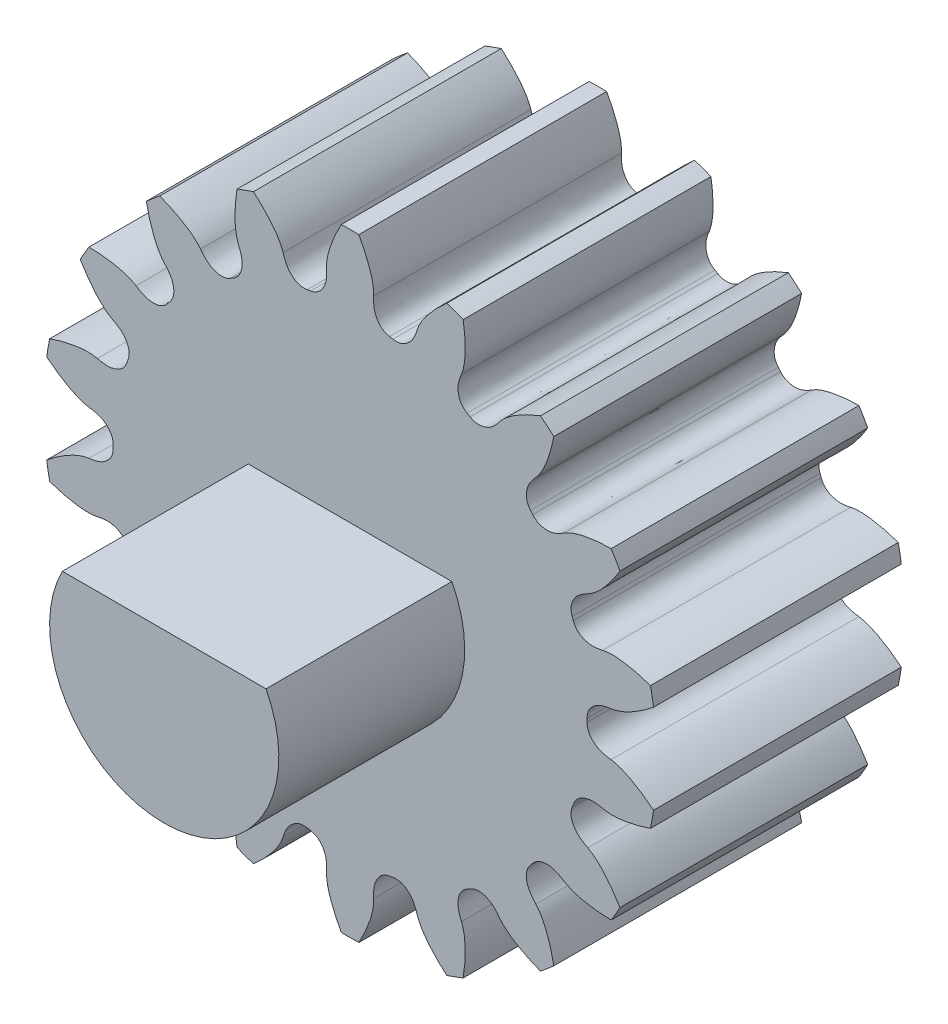
from build123d import *

# Parameters (mm, degrees)
SKETCH1_R           = 5.5
EXTRUDE1_DEPTH      = 4
EXTRUDE2_DEPTH      = 3
EXTRUDE3_DEPTH      = 3.5
EXTRUDE5_DEPTH      = 11.464224768
EXTRUDE5_DEPTH_BACK = 11.464224768
SKETCH4_R           = 6.338783536


with BuildPart() as part:
    # Sketch1 → Extrude1 (new body)
    with BuildSketch(Plane.XY):
        Circle(SKETCH1_R)
    extrude(amount=EXTRUDE1_DEPTH)

    # Sketch2 → Extrude2 (add)
    with BuildSketch(Plane.XY.offset(4)):
        with BuildLine():
            ThreePointArc((-1.643167673, 0.85), (0, -1.85), (1.643167673, 0.85))
            Line((1.643167673, 0.85), (-1.643167673, 0.85))
        make_face()
    extrude(amount=EXTRUDE2_DEPTH)

    # Sketch3 → Extrude3 (cut)
    with BuildSketch(Plane(origin=(0, 0, 0), x_dir=(-1, 0, 0), z_dir=(0, 0, -1))):
        with BuildLine():
            ThreePointArc((-1.183215957, 1.15), (0, -1.65), (1.183215957, 1.15))
            Line((1.183215957, 1.15), (-1.183215957, 1.15))
        make_face()
    extrude(amount=-EXTRUDE3_DEPTH, mode=Mode.SUBTRACT)

    # Sketch4 → Extrude5 (cut, two sides: drawn at the far end of the back side and taken through both)
    with BuildSketch(Plane.XY.offset(-EXTRUDE5_DEPTH_BACK)):
        Circle(SKETCH4_R)
        with BuildLine():
            ThreePointArc((-0.691151214, 3.762038676), (-0.66420428, 3.766889655), (-0.637223312, 3.77154762))
            add(Edge.make_bspline(
                [(-0.381405681, 4.210463921), (-0.375972683, 4.159720025), (-0.383883595, 4.03873467), (-0.414747483, 3.946280352), (-0.490121942, 3.822486209), (-0.574468933, 3.782224973), (-0.637223312, 3.77154762)],
                knots=[0.015932796, 0.015932796, 0.015932796, 0.015932796, 1.139046187, 2.262159578, 4.50838636, 9.000839924, 9.000839924, 9.000839924, 9.000839924], degree=3))
            add(Edge.make_bspline(
                [(-0.141013461, 4.947991027), (-0.20898124, 4.828846411), (-0.328175986, 4.566308486), (-0.383593226, 4.333731547), (-0.381405681, 4.210463921)],
                knots=[0.026609296, 0.026609296, 0.026609296, 0.026609296, 4.373386474, 8.720163651, 8.720163651, 8.720163651, 8.720163651], degree=3))
            ThreePointArc((-0.141013461, 4.947991027), (0, 4.95), (0.141013461, 4.947991027))
            add(Edge.make_bspline(
                [(0.381405681, 4.210463921), (0.383593226, 4.333731547), (0.328175986, 4.566308486), (0.20898124, 4.828846411), (0.141013461, 4.947991027)],
                knots=[0.026609296, 0.026609296, 0.026609296, 0.026609296, 4.373386474, 8.720163651, 8.720163651, 8.720163651, 8.720163651], degree=3))
            add(Edge.make_bspline(
                [(0.637223312, 3.77154762), (0.574468933, 3.782224973), (0.490121942, 3.822486209), (0.414747483, 3.946280352), (0.383883595, 4.03873467), (0.375972683, 4.159720025), (0.381405681, 4.210463921)],
                knots=[0.015932796, 0.015932796, 0.015932796, 0.015932796, 4.50838636, 6.754613142, 7.877726533, 9.000839924, 9.000839924, 9.000839924, 9.000839924], degree=3))
            ThreePointArc((0.637223312, 3.77154762), (0.66420428, 3.766889655), (0.691151214, 3.762038676))
            add(Edge.make_bspline(
                [(1.081659369, 4.086990302), (1.069409283, 4.037448443), (1.020596029, 3.926465089), (0.959972222, 3.85014252), (0.846803309, 3.75959366), (0.75377291, 3.750608844), (0.691151214, 3.762038676)],
                knots=[0.015932796, 0.015932796, 0.015932796, 0.015932796, 1.139046187, 2.262159578, 4.50838636, 9.000839924, 9.000839924, 9.000839924, 9.000839924], degree=3))
            add(Edge.make_bspline(
                [(1.559803292, 4.6978201), (1.455184612, 4.609107133), (1.253384931, 4.403169186), (1.121763761, 4.203572165), (1.081659369, 4.086990302)],
                knots=[0.026609296, 0.026609296, 0.026609296, 0.026609296, 4.373386474, 8.720163651, 8.720163651, 8.720163651, 8.720163651], degree=3))
            ThreePointArc((1.559803292, 4.6978201), (1.692999709, 4.651478473), (1.824821909, 4.601361212))
            add(Edge.make_bspline(
                [(1.798467578, 3.826093451), (1.842683209, 3.941178945), (1.870154035, 4.178683591), (1.847940871, 4.466155545), (1.824821909, 4.601361212)],
                knots=[0.026609296, 0.026609296, 0.026609296, 0.026609296, 4.373386474, 8.720163651, 8.720163651, 8.720163651, 8.720163651], degree=3))
            add(Edge.make_bspline(
                [(1.888739301, 3.326152259), (1.833421345, 3.35764895), (1.767931253, 3.424330507), (1.739442521, 3.566438533), (1.742061192, 3.663873244), (1.776006795, 3.780267981), (1.798467578, 3.826093451)],
                knots=[0.015932796, 0.015932796, 0.015932796, 0.015932796, 4.50838636, 6.754613142, 7.877726533, 9.000839924, 9.000839924, 9.000839924, 9.000839924], degree=3))
            ThreePointArc((1.888739301, 3.326152259), (1.9125, 3.312547169), (1.936162703, 3.298772346))
            add(Edge.make_bspline(
                [(2.414260337, 3.470565336), (2.385804707, 3.428200992), (2.301976709, 3.34060587), (2.21890511, 3.289620678), (2.081591583, 3.243238631), (1.991098615, 3.266613936), (1.936162703, 3.298772346)],
                knots=[0.015932796, 0.015932796, 0.015932796, 0.015932796, 1.139046187, 2.262159578, 4.50838636, 9.000839924, 9.000839924, 9.000839924, 9.000839924], degree=3))
            add(Edge.make_bspline(
                [(3.072484747, 3.881022736), (2.943833724, 3.833441512), (2.683769127, 3.708942699), (2.491819483, 3.566399942), (2.414260337, 3.470565336)],
                knots=[0.026609296, 0.026609296, 0.026609296, 0.026609296, 4.373386474, 8.720163651, 8.720163651, 8.720163651, 8.720163651], degree=3))
            ThreePointArc((3.072484747, 3.881022736), (3.181798668, 3.791919993), (3.288529903, 3.699739326))
            add(Edge.make_bspline(
                [(2.998607742, 2.980239643), (3.079518401, 3.073261997), (3.186563907, 3.287047784), (3.26401156, 3.564780408), (3.288529903, 3.699739326)],
                knots=[0.026609296, 0.026609296, 0.026609296, 0.026609296, 4.373386474, 8.720163651, 8.720163651, 8.720163651, 8.720163651], degree=3))
            add(Edge.make_bspline(
                [(2.912445457, 2.479573847), (2.871236084, 2.528090911), (2.832501963, 2.613150008), (2.854335119, 2.756431592), (2.8901205, 2.847094632), (2.961828276, 2.944859827), (2.998607742, 2.980239643)],
                knots=[0.015932796, 0.015932796, 0.015932796, 0.015932796, 4.50838636, 6.754613142, 7.877726533, 9.000839924, 9.000839924, 9.000839924, 9.000839924], degree=3))
            ThreePointArc((2.912445457, 2.479573847), (2.930119995, 2.458662607), (2.947644395, 2.437625386))
            add(Edge.make_bspline(
                [(3.455665876, 2.435538969), (3.414436872, 2.405461907), (3.305705025, 2.351820281), (3.210205294, 2.332322032), (3.065309192, 2.335701157), (2.988268443, 2.388617176), (2.947644395, 2.437625386)],
                knots=[0.015932796, 0.015932796, 0.015932796, 0.015932796, 1.139046187, 2.262159578, 4.50838636, 9.000839924, 9.000839924, 9.000839924, 9.000839924], degree=3))
            add(Edge.make_bspline(
                [(4.214579197, 2.596116753), (4.077413043, 2.595406269), (3.790451158, 2.567362983), (3.561325, 2.499067252), (3.455665876, 2.435538969)],
                knots=[0.026609296, 0.026609296, 0.026609296, 0.026609296, 4.373386474, 8.720163651, 8.720163651, 8.720163651, 8.720163651], degree=3))
            ThreePointArc((4.214579197, 2.596116753), (4.286825749, 2.475), (4.355592657, 2.351874274))
            add(Edge.make_bspline(
                [(3.837071558, 1.774924951), (3.944918226, 1.834664295), (4.118627143, 1.998945503), (4.286394283, 2.233440142), (4.355592657, 2.351874274)],
                knots=[0.026609296, 0.026609296, 0.026609296, 0.026609296, 4.373386474, 8.720163651, 8.720163651, 8.720163651, 8.720163651], degree=3))
            add(Edge.make_bspline(
                [(3.584867706, 1.333922234), (3.562737376, 1.393607796), (3.555431134, 1.486785052), (3.624952777, 1.61395832), (3.689588621, 1.686914389), (3.790409556, 1.754258118), (3.837071558, 1.774924951)],
                knots=[0.015932796, 0.015932796, 0.015932796, 0.015932796, 4.50838636, 6.754613142, 7.877726533, 9.000839924, 9.000839924, 9.000839924, 9.000839924], degree=3))
            ThreePointArc((3.584867706, 1.333922234), (3.594324275, 1.308227048), (3.60359667, 1.282464829))
            add(Edge.make_bspline(
                [(4.080267111, 1.106750659), (4.031237559, 1.092588615), (3.910716528, 1.079370457), (3.814307342, 1.093710928), (3.679305272, 1.146443653), (3.625008994, 1.222517933), (3.60359667, 1.282464829)],
                knots=[0.015932796, 0.015932796, 0.015932796, 0.015932796, 1.139046187, 2.262159578, 4.50838636, 9.000839924, 9.000839924, 9.000839924, 9.000839924], degree=3))
            add(Edge.make_bspline(
                [(4.848333195, 0.998080774), (4.719196172, 1.044326725), (4.439948838, 1.116121402), (4.201282162, 1.130310169), (4.080267111, 1.106750659)],
                knots=[0.026609296, 0.026609296, 0.026609296, 0.026609296, 4.373386474, 8.720163651, 8.720163651, 8.720163651, 8.720163651], degree=3))
            ThreePointArc((4.848333195, 0.998080774), (4.874798377, 0.859558479), (4.897306656, 0.720338476))
            add(Edge.make_bspline(
                [(4.212727914, 0.355528115), (4.334502692, 0.374779003), (4.553923161, 0.469740892), (4.791774595, 0.632714034), (4.897306656, 0.720338476)],
                knots=[0.026609296, 0.026609296, 0.026609296, 0.026609296, 4.373386474, 8.720163651, 8.720163651, 8.720163651, 8.720163651], degree=3))
            add(Edge.make_bspline(
                [(3.824902004, 0.027379913), (3.82451996, 0.091035015), (3.849522836, 0.181091876), (3.958347631, 0.276817855), (4.044037902, 0.323267374), (4.161811502, 0.352066988), (4.212727914, 0.355528115)],
                knots=[0.015932796, 0.015932796, 0.015932796, 0.015932796, 4.50838636, 6.754613142, 7.877726533, 9.000839924, 9.000839924, 9.000839924, 9.000839924], degree=3))
            ThreePointArc((3.824902004, 0.027379913), (3.825, 0), (3.824902004, -0.027379913))
            add(Edge.make_bspline(
                [(4.212727914, -0.355528115), (4.161811502, -0.352066988), (4.044037902, -0.323267374), (3.958347631, -0.276817855), (3.849522836, -0.181091876), (3.82451996, -0.091035015), (3.824902004, -0.027379913)],
                knots=[0.015932796, 0.015932796, 0.015932796, 0.015932796, 1.139046187, 2.262159578, 4.50838636, 9.000839924, 9.000839924, 9.000839924, 9.000839924], degree=3))
            add(Edge.make_bspline(
                [(4.897306656, -0.720338476), (4.791774595, -0.632714034), (4.553923161, -0.469740892), (4.334502692, -0.374779003), (4.212727914, -0.355528115)],
                knots=[0.026609296, 0.026609296, 0.026609296, 0.026609296, 4.373386474, 8.720163651, 8.720163651, 8.720163651, 8.720163651], degree=3))
            ThreePointArc((4.897306656, -0.720338476), (4.874798377, -0.859558479), (4.848333195, -0.998080774))
            add(Edge.make_bspline(
                [(4.080267111, -1.106750659), (4.201282162, -1.130310169), (4.439948838, -1.116121402), (4.719196172, -1.044326725), (4.848333195, -0.998080774)],
                knots=[0.026609296, 0.026609296, 0.026609296, 0.026609296, 4.373386474, 8.720163651, 8.720163651, 8.720163651, 8.720163651], degree=3))
            add(Edge.make_bspline(
                [(3.60359667, -1.282464829), (3.625008994, -1.222517933), (3.679305272, -1.146443653), (3.814307342, -1.093710928), (3.910716528, -1.079370457), (4.031237559, -1.092588615), (4.080267111, -1.106750659)],
                knots=[0.015932796, 0.015932796, 0.015932796, 0.015932796, 4.50838636, 6.754613142, 7.877726533, 9.000839924, 9.000839924, 9.000839924, 9.000839924], degree=3))
            ThreePointArc((3.60359667, -1.282464829), (3.594324275, -1.308227048), (3.584867706, -1.333922234))
            add(Edge.make_bspline(
                [(3.837071558, -1.774924951), (3.790409556, -1.754258118), (3.689588621, -1.686914389), (3.624952777, -1.61395832), (3.555431134, -1.486785052), (3.562737376, -1.393607796), (3.584867706, -1.333922234)],
                knots=[0.015932796, 0.015932796, 0.015932796, 0.015932796, 1.139046187, 2.262159578, 4.50838636, 9.000839924, 9.000839924, 9.000839924, 9.000839924], degree=3))
            add(Edge.make_bspline(
                [(4.355592657, -2.351874274), (4.286394283, -2.233440142), (4.118627143, -1.998945503), (3.944918226, -1.834664295), (3.837071558, -1.774924951)],
                knots=[0.026609296, 0.026609296, 0.026609296, 0.026609296, 4.373386474, 8.720163651, 8.720163651, 8.720163651, 8.720163651], degree=3))
            ThreePointArc((4.355592657, -2.351874274), (4.286825749, -2.475), (4.214579197, -2.596116753))
            add(Edge.make_bspline(
                [(3.455665876, -2.435538969), (3.561325, -2.499067252), (3.790451158, -2.567362983), (4.077413043, -2.595406269), (4.214579197, -2.596116753)],
                knots=[0.026609296, 0.026609296, 0.026609296, 0.026609296, 4.373386474, 8.720163651, 8.720163651, 8.720163651, 8.720163651], degree=3))
            add(Edge.make_bspline(
                [(2.947644395, -2.437625386), (2.988268443, -2.388617176), (3.065309192, -2.335701157), (3.210205294, -2.332322032), (3.305705025, -2.351820281), (3.414436872, -2.405461907), (3.455665876, -2.435538969)],
                knots=[0.015932796, 0.015932796, 0.015932796, 0.015932796, 4.50838636, 6.754613142, 7.877726533, 9.000839924, 9.000839924, 9.000839924, 9.000839924], degree=3))
            ThreePointArc((2.947644395, -2.437625386), (2.930119995, -2.458662607), (2.912445457, -2.479573847))
            add(Edge.make_bspline(
                [(2.998607742, -2.980239643), (2.961828276, -2.944859827), (2.8901205, -2.847094632), (2.854335119, -2.756431592), (2.832501963, -2.613150008), (2.871236084, -2.528090911), (2.912445457, -2.479573847)],
                knots=[0.015932796, 0.015932796, 0.015932796, 0.015932796, 1.139046187, 2.262159578, 4.50838636, 9.000839924, 9.000839924, 9.000839924, 9.000839924], degree=3))
            add(Edge.make_bspline(
                [(3.288529903, -3.699739326), (3.26401156, -3.564780408), (3.186563907, -3.287047784), (3.079518401, -3.073261997), (2.998607742, -2.980239643)],
                knots=[0.026609296, 0.026609296, 0.026609296, 0.026609296, 4.373386474, 8.720163651, 8.720163651, 8.720163651, 8.720163651], degree=3))
            ThreePointArc((3.288529903, -3.699739326), (3.181798668, -3.791919993), (3.072484747, -3.881022736))
            add(Edge.make_bspline(
                [(2.414260337, -3.470565336), (2.491819483, -3.566399942), (2.683769127, -3.708942699), (2.943833724, -3.833441512), (3.072484747, -3.881022736)],
                knots=[0.026609296, 0.026609296, 0.026609296, 0.026609296, 4.373386474, 8.720163651, 8.720163651, 8.720163651, 8.720163651], degree=3))
            add(Edge.make_bspline(
                [(1.936162703, -3.298772346), (1.991098615, -3.266613936), (2.081591583, -3.243238631), (2.21890511, -3.289620678), (2.301976709, -3.34060587), (2.385804707, -3.428200992), (2.414260337, -3.470565336)],
                knots=[0.015932796, 0.015932796, 0.015932796, 0.015932796, 4.50838636, 6.754613142, 7.877726533, 9.000839924, 9.000839924, 9.000839924, 9.000839924], degree=3))
            ThreePointArc((1.936162703, -3.298772346), (1.9125, -3.312547169), (1.888739301, -3.326152259))
            add(Edge.make_bspline(
                [(1.798467578, -3.826093451), (1.776006795, -3.780267981), (1.742061192, -3.663873244), (1.739442521, -3.566438533), (1.767931253, -3.424330507), (1.833421345, -3.35764895), (1.888739301, -3.326152259)],
                knots=[0.015932796, 0.015932796, 0.015932796, 0.015932796, 1.139046187, 2.262159578, 4.50838636, 9.000839924, 9.000839924, 9.000839924, 9.000839924], degree=3))
            add(Edge.make_bspline(
                [(1.824821909, -4.601361212), (1.847940871, -4.466155545), (1.870154035, -4.178683591), (1.842683209, -3.941178945), (1.798467578, -3.826093451)],
                knots=[0.026609296, 0.026609296, 0.026609296, 0.026609296, 4.373386474, 8.720163651, 8.720163651, 8.720163651, 8.720163651], degree=3))
            ThreePointArc((1.824821909, -4.601361212), (1.692999709, -4.651478473), (1.559803292, -4.6978201))
            add(Edge.make_bspline(
                [(1.081659369, -4.086990302), (1.121763761, -4.203572165), (1.253384931, -4.403169186), (1.455184612, -4.609107133), (1.559803292, -4.6978201)],
                knots=[0.026609296, 0.026609296, 0.026609296, 0.026609296, 4.373386474, 8.720163651, 8.720163651, 8.720163651, 8.720163651], degree=3))
            add(Edge.make_bspline(
                [(0.691151214, -3.762038676), (0.75377291, -3.750608844), (0.846803309, -3.75959366), (0.959972222, -3.85014252), (1.020596029, -3.926465089), (1.069409283, -4.037448443), (1.081659369, -4.086990302)],
                knots=[0.015932796, 0.015932796, 0.015932796, 0.015932796, 4.50838636, 6.754613142, 7.877726533, 9.000839924, 9.000839924, 9.000839924, 9.000839924], degree=3))
            ThreePointArc((0.691151214, -3.762038676), (0.66420428, -3.766889655), (0.637223312, -3.77154762))
            add(Edge.make_bspline(
                [(0.381405681, -4.210463921), (0.375972683, -4.159720025), (0.383883595, -4.03873467), (0.414747483, -3.946280352), (0.490121942, -3.822486209), (0.574468933, -3.782224973), (0.637223312, -3.77154762)],
                knots=[0.015932796, 0.015932796, 0.015932796, 0.015932796, 1.139046187, 2.262159578, 4.50838636, 9.000839924, 9.000839924, 9.000839924, 9.000839924], degree=3))
            add(Edge.make_bspline(
                [(0.141013461, -4.947991027), (0.20898124, -4.828846411), (0.328175986, -4.566308486), (0.383593226, -4.333731547), (0.381405681, -4.210463921)],
                knots=[0.026609296, 0.026609296, 0.026609296, 0.026609296, 4.373386474, 8.720163651, 8.720163651, 8.720163651, 8.720163651], degree=3))
            ThreePointArc((0.141013461, -4.947991027), (0, -4.95), (-0.141013461, -4.947991027))
            add(Edge.make_bspline(
                [(-0.381405681, -4.210463921), (-0.383593226, -4.333731547), (-0.328175986, -4.566308486), (-0.20898124, -4.828846411), (-0.141013461, -4.947991027)],
                knots=[0.026609296, 0.026609296, 0.026609296, 0.026609296, 4.373386474, 8.720163651, 8.720163651, 8.720163651, 8.720163651], degree=3))
            add(Edge.make_bspline(
                [(-0.637223312, -3.77154762), (-0.574468933, -3.782224973), (-0.490121942, -3.822486209), (-0.414747483, -3.946280352), (-0.383883595, -4.03873467), (-0.375972683, -4.159720025), (-0.381405681, -4.210463921)],
                knots=[0.015932796, 0.015932796, 0.015932796, 0.015932796, 4.50838636, 6.754613142, 7.877726533, 9.000839924, 9.000839924, 9.000839924, 9.000839924], degree=3))
            ThreePointArc((-0.637223312, -3.77154762), (-0.66420428, -3.766889655), (-0.691151214, -3.762038676))
            add(Edge.make_bspline(
                [(-1.081659369, -4.086990302), (-1.069409283, -4.037448443), (-1.020596029, -3.926465089), (-0.959972222, -3.85014252), (-0.846803309, -3.75959366), (-0.75377291, -3.750608844), (-0.691151214, -3.762038676)],
                knots=[0.015932796, 0.015932796, 0.015932796, 0.015932796, 1.139046187, 2.262159578, 4.50838636, 9.000839924, 9.000839924, 9.000839924, 9.000839924], degree=3))
            add(Edge.make_bspline(
                [(-1.559803292, -4.6978201), (-1.455184612, -4.609107133), (-1.253384931, -4.403169186), (-1.121763761, -4.203572165), (-1.081659369, -4.086990302)],
                knots=[0.026609296, 0.026609296, 0.026609296, 0.026609296, 4.373386474, 8.720163651, 8.720163651, 8.720163651, 8.720163651], degree=3))
            ThreePointArc((-1.559803292, -4.6978201), (-1.692999709, -4.651478473), (-1.824821909, -4.601361212))
            add(Edge.make_bspline(
                [(-1.798467578, -3.826093451), (-1.842683209, -3.941178945), (-1.870154035, -4.178683591), (-1.847940871, -4.466155545), (-1.824821909, -4.601361212)],
                knots=[0.026609296, 0.026609296, 0.026609296, 0.026609296, 4.373386474, 8.720163651, 8.720163651, 8.720163651, 8.720163651], degree=3))
            add(Edge.make_bspline(
                [(-1.888739301, -3.326152259), (-1.833421345, -3.35764895), (-1.767931253, -3.424330507), (-1.739442521, -3.566438533), (-1.742061192, -3.663873244), (-1.776006795, -3.780267981), (-1.798467578, -3.826093451)],
                knots=[0.015932796, 0.015932796, 0.015932796, 0.015932796, 4.50838636, 6.754613142, 7.877726533, 9.000839924, 9.000839924, 9.000839924, 9.000839924], degree=3))
            ThreePointArc((-1.888739301, -3.326152259), (-1.9125, -3.312547169), (-1.936162703, -3.298772346))
            add(Edge.make_bspline(
                [(-2.414260337, -3.470565336), (-2.385804707, -3.428200992), (-2.301976709, -3.34060587), (-2.21890511, -3.289620678), (-2.081591583, -3.243238631), (-1.991098615, -3.266613936), (-1.936162703, -3.298772346)],
                knots=[0.015932796, 0.015932796, 0.015932796, 0.015932796, 1.139046187, 2.262159578, 4.50838636, 9.000839924, 9.000839924, 9.000839924, 9.000839924], degree=3))
            add(Edge.make_bspline(
                [(-3.072484747, -3.881022736), (-2.943833724, -3.833441512), (-2.683769127, -3.708942699), (-2.491819483, -3.566399942), (-2.414260337, -3.470565336)],
                knots=[0.026609296, 0.026609296, 0.026609296, 0.026609296, 4.373386474, 8.720163651, 8.720163651, 8.720163651, 8.720163651], degree=3))
            ThreePointArc((-3.072484747, -3.881022736), (-3.181798668, -3.791919993), (-3.288529903, -3.699739326))
            add(Edge.make_bspline(
                [(-2.998607742, -2.980239643), (-3.079518401, -3.073261997), (-3.186563907, -3.287047784), (-3.26401156, -3.564780408), (-3.288529903, -3.699739326)],
                knots=[0.026609296, 0.026609296, 0.026609296, 0.026609296, 4.373386474, 8.720163651, 8.720163651, 8.720163651, 8.720163651], degree=3))
            add(Edge.make_bspline(
                [(-2.912445457, -2.479573847), (-2.871236084, -2.528090911), (-2.832501963, -2.613150008), (-2.854335119, -2.756431592), (-2.8901205, -2.847094632), (-2.961828276, -2.944859827), (-2.998607742, -2.980239643)],
                knots=[0.015932796, 0.015932796, 0.015932796, 0.015932796, 4.50838636, 6.754613142, 7.877726533, 9.000839924, 9.000839924, 9.000839924, 9.000839924], degree=3))
            ThreePointArc((-2.912445457, -2.479573847), (-2.930119995, -2.458662607), (-2.947644395, -2.437625386))
            add(Edge.make_bspline(
                [(-3.455665876, -2.435538969), (-3.414436872, -2.405461907), (-3.305705025, -2.351820281), (-3.210205294, -2.332322032), (-3.065309192, -2.335701157), (-2.988268443, -2.388617176), (-2.947644395, -2.437625386)],
                knots=[0.015932796, 0.015932796, 0.015932796, 0.015932796, 1.139046187, 2.262159578, 4.50838636, 9.000839924, 9.000839924, 9.000839924, 9.000839924], degree=3))
            add(Edge.make_bspline(
                [(-4.214579197, -2.596116753), (-4.077413043, -2.595406269), (-3.790451158, -2.567362983), (-3.561325, -2.499067252), (-3.455665876, -2.435538969)],
                knots=[0.026609296, 0.026609296, 0.026609296, 0.026609296, 4.373386474, 8.720163651, 8.720163651, 8.720163651, 8.720163651], degree=3))
            ThreePointArc((-4.214579197, -2.596116753), (-4.286825749, -2.475), (-4.355592657, -2.351874274))
            add(Edge.make_bspline(
                [(-3.837071558, -1.774924951), (-3.944918226, -1.834664295), (-4.118627143, -1.998945503), (-4.286394283, -2.233440142), (-4.355592657, -2.351874274)],
                knots=[0.026609296, 0.026609296, 0.026609296, 0.026609296, 4.373386474, 8.720163651, 8.720163651, 8.720163651, 8.720163651], degree=3))
            add(Edge.make_bspline(
                [(-3.584867706, -1.333922234), (-3.562737376, -1.393607796), (-3.555431134, -1.486785052), (-3.624952777, -1.61395832), (-3.689588621, -1.686914389), (-3.790409556, -1.754258118), (-3.837071558, -1.774924951)],
                knots=[0.015932796, 0.015932796, 0.015932796, 0.015932796, 4.50838636, 6.754613142, 7.877726533, 9.000839924, 9.000839924, 9.000839924, 9.000839924], degree=3))
            ThreePointArc((-3.584867706, -1.333922234), (-3.594324275, -1.308227048), (-3.60359667, -1.282464829))
            add(Edge.make_bspline(
                [(-4.080267111, -1.106750659), (-4.031237559, -1.092588615), (-3.910716528, -1.079370457), (-3.814307342, -1.093710928), (-3.679305272, -1.146443653), (-3.625008994, -1.222517933), (-3.60359667, -1.282464829)],
                knots=[0.015932796, 0.015932796, 0.015932796, 0.015932796, 1.139046187, 2.262159578, 4.50838636, 9.000839924, 9.000839924, 9.000839924, 9.000839924], degree=3))
            add(Edge.make_bspline(
                [(-4.848333195, -0.998080774), (-4.719196172, -1.044326725), (-4.439948838, -1.116121402), (-4.201282162, -1.130310169), (-4.080267111, -1.106750659)],
                knots=[0.026609296, 0.026609296, 0.026609296, 0.026609296, 4.373386474, 8.720163651, 8.720163651, 8.720163651, 8.720163651], degree=3))
            ThreePointArc((-4.848333195, -0.998080774), (-4.874798377, -0.859558479), (-4.897306656, -0.720338476))
            add(Edge.make_bspline(
                [(-4.212727914, -0.355528115), (-4.334502692, -0.374779003), (-4.553923161, -0.469740892), (-4.791774595, -0.632714034), (-4.897306656, -0.720338476)],
                knots=[0.026609296, 0.026609296, 0.026609296, 0.026609296, 4.373386474, 8.720163651, 8.720163651, 8.720163651, 8.720163651], degree=3))
            add(Edge.make_bspline(
                [(-3.824902004, -0.027379913), (-3.82451996, -0.091035015), (-3.849522836, -0.181091876), (-3.958347631, -0.276817855), (-4.044037902, -0.323267374), (-4.161811502, -0.352066988), (-4.212727914, -0.355528115)],
                knots=[0.015932796, 0.015932796, 0.015932796, 0.015932796, 4.50838636, 6.754613142, 7.877726533, 9.000839924, 9.000839924, 9.000839924, 9.000839924], degree=3))
            ThreePointArc((-3.824902004, -0.027379913), (-3.825, 0), (-3.824902004, 0.027379913))
            add(Edge.make_bspline(
                [(-4.212727914, 0.355528115), (-4.161811502, 0.352066988), (-4.044037902, 0.323267374), (-3.958347631, 0.276817855), (-3.849522836, 0.181091876), (-3.82451996, 0.091035015), (-3.824902004, 0.027379913)],
                knots=[0.015932796, 0.015932796, 0.015932796, 0.015932796, 1.139046187, 2.262159578, 4.50838636, 9.000839924, 9.000839924, 9.000839924, 9.000839924], degree=3))
            add(Edge.make_bspline(
                [(-4.897306656, 0.720338476), (-4.791774595, 0.632714034), (-4.553923161, 0.469740892), (-4.334502692, 0.374779003), (-4.212727914, 0.355528115)],
                knots=[0.026609296, 0.026609296, 0.026609296, 0.026609296, 4.373386474, 8.720163651, 8.720163651, 8.720163651, 8.720163651], degree=3))
            ThreePointArc((-4.897306656, 0.720338476), (-4.874798377, 0.859558479), (-4.848333195, 0.998080774))
            add(Edge.make_bspline(
                [(-4.080267111, 1.106750659), (-4.201282162, 1.130310169), (-4.439948838, 1.116121402), (-4.719196172, 1.044326725), (-4.848333195, 0.998080774)],
                knots=[0.026609296, 0.026609296, 0.026609296, 0.026609296, 4.373386474, 8.720163651, 8.720163651, 8.720163651, 8.720163651], degree=3))
            add(Edge.make_bspline(
                [(-3.60359667, 1.282464829), (-3.625008994, 1.222517933), (-3.679305272, 1.146443653), (-3.814307342, 1.093710928), (-3.910716528, 1.079370457), (-4.031237559, 1.092588615), (-4.080267111, 1.106750659)],
                knots=[0.015932796, 0.015932796, 0.015932796, 0.015932796, 4.50838636, 6.754613142, 7.877726533, 9.000839924, 9.000839924, 9.000839924, 9.000839924], degree=3))
            ThreePointArc((-3.60359667, 1.282464829), (-3.594324275, 1.308227048), (-3.584867706, 1.333922234))
            add(Edge.make_bspline(
                [(-3.837071558, 1.774924951), (-3.790409556, 1.754258118), (-3.689588621, 1.686914389), (-3.624952777, 1.61395832), (-3.555431134, 1.486785052), (-3.562737376, 1.393607796), (-3.584867706, 1.333922234)],
                knots=[0.015932796, 0.015932796, 0.015932796, 0.015932796, 1.139046187, 2.262159578, 4.50838636, 9.000839924, 9.000839924, 9.000839924, 9.000839924], degree=3))
            add(Edge.make_bspline(
                [(-4.355592657, 2.351874274), (-4.286394283, 2.233440142), (-4.118627143, 1.998945503), (-3.944918226, 1.834664295), (-3.837071558, 1.774924951)],
                knots=[0.026609296, 0.026609296, 0.026609296, 0.026609296, 4.373386474, 8.720163651, 8.720163651, 8.720163651, 8.720163651], degree=3))
            ThreePointArc((-4.355592657, 2.351874274), (-4.286825749, 2.475), (-4.214579197, 2.596116753))
            add(Edge.make_bspline(
                [(-3.455665876, 2.435538969), (-3.561325, 2.499067252), (-3.790451158, 2.567362983), (-4.077413043, 2.595406269), (-4.214579197, 2.596116753)],
                knots=[0.026609296, 0.026609296, 0.026609296, 0.026609296, 4.373386474, 8.720163651, 8.720163651, 8.720163651, 8.720163651], degree=3))
            add(Edge.make_bspline(
                [(-2.947644395, 2.437625386), (-2.988268443, 2.388617176), (-3.065309192, 2.335701157), (-3.210205294, 2.332322032), (-3.305705025, 2.351820281), (-3.414436872, 2.405461907), (-3.455665876, 2.435538969)],
                knots=[0.015932796, 0.015932796, 0.015932796, 0.015932796, 4.50838636, 6.754613142, 7.877726533, 9.000839924, 9.000839924, 9.000839924, 9.000839924], degree=3))
            ThreePointArc((-2.947644395, 2.437625386), (-2.930119995, 2.458662607), (-2.912445457, 2.479573847))
            add(Edge.make_bspline(
                [(-2.998607742, 2.980239643), (-2.961828276, 2.944859827), (-2.8901205, 2.847094632), (-2.854335119, 2.756431592), (-2.832501963, 2.613150008), (-2.871236084, 2.528090911), (-2.912445457, 2.479573847)],
                knots=[0.015932796, 0.015932796, 0.015932796, 0.015932796, 1.139046187, 2.262159578, 4.50838636, 9.000839924, 9.000839924, 9.000839924, 9.000839924], degree=3))
            add(Edge.make_bspline(
                [(-3.288529903, 3.699739326), (-3.26401156, 3.564780408), (-3.186563907, 3.287047784), (-3.079518401, 3.073261997), (-2.998607742, 2.980239643)],
                knots=[0.026609296, 0.026609296, 0.026609296, 0.026609296, 4.373386474, 8.720163651, 8.720163651, 8.720163651, 8.720163651], degree=3))
            ThreePointArc((-3.288529903, 3.699739326), (-3.181798668, 3.791919993), (-3.072484747, 3.881022736))
            add(Edge.make_bspline(
                [(-2.414260337, 3.470565336), (-2.491819483, 3.566399942), (-2.683769127, 3.708942699), (-2.943833724, 3.833441512), (-3.072484747, 3.881022736)],
                knots=[0.026609296, 0.026609296, 0.026609296, 0.026609296, 4.373386474, 8.720163651, 8.720163651, 8.720163651, 8.720163651], degree=3))
            add(Edge.make_bspline(
                [(-1.936162703, 3.298772346), (-1.991098615, 3.266613936), (-2.081591583, 3.243238631), (-2.21890511, 3.289620678), (-2.301976709, 3.34060587), (-2.385804707, 3.428200992), (-2.414260337, 3.470565336)],
                knots=[0.015932796, 0.015932796, 0.015932796, 0.015932796, 4.50838636, 6.754613142, 7.877726533, 9.000839924, 9.000839924, 9.000839924, 9.000839924], degree=3))
            ThreePointArc((-1.936162703, 3.298772346), (-1.9125, 3.312547169), (-1.888739301, 3.326152259))
            add(Edge.make_bspline(
                [(-1.798467578, 3.826093451), (-1.776006795, 3.780267981), (-1.742061192, 3.663873244), (-1.739442521, 3.566438533), (-1.767931253, 3.424330507), (-1.833421345, 3.35764895), (-1.888739301, 3.326152259)],
                knots=[0.015932796, 0.015932796, 0.015932796, 0.015932796, 1.139046187, 2.262159578, 4.50838636, 9.000839924, 9.000839924, 9.000839924, 9.000839924], degree=3))
            add(Edge.make_bspline(
                [(-1.824821909, 4.601361212), (-1.847940871, 4.466155545), (-1.870154035, 4.178683591), (-1.842683209, 3.941178945), (-1.798467578, 3.826093451)],
                knots=[0.026609296, 0.026609296, 0.026609296, 0.026609296, 4.373386474, 8.720163651, 8.720163651, 8.720163651, 8.720163651], degree=3))
            ThreePointArc((-1.824821909, 4.601361212), (-1.692999709, 4.651478473), (-1.559803292, 4.6978201))
            add(Edge.make_bspline(
                [(-1.081659369, 4.086990302), (-1.121763761, 4.203572165), (-1.253384931, 4.403169186), (-1.455184612, 4.609107133), (-1.559803292, 4.6978201)],
                knots=[0.026609296, 0.026609296, 0.026609296, 0.026609296, 4.373386474, 8.720163651, 8.720163651, 8.720163651, 8.720163651], degree=3))
            add(Edge.make_bspline(
                [(-0.691151214, 3.762038676), (-0.75377291, 3.750608844), (-0.846803309, 3.75959366), (-0.959972222, 3.85014252), (-1.020596029, 3.926465089), (-1.069409283, 4.037448443), (-1.081659369, 4.086990302)],
                knots=[0.015932796, 0.015932796, 0.015932796, 0.015932796, 4.50838636, 6.754613142, 7.877726533, 9.000839924, 9.000839924, 9.000839924, 9.000839924], degree=3))
        make_face(mode=Mode.SUBTRACT)
    extrude(amount=EXTRUDE5_DEPTH + EXTRUDE5_DEPTH_BACK, mode=Mode.SUBTRACT)


solid = part.part
